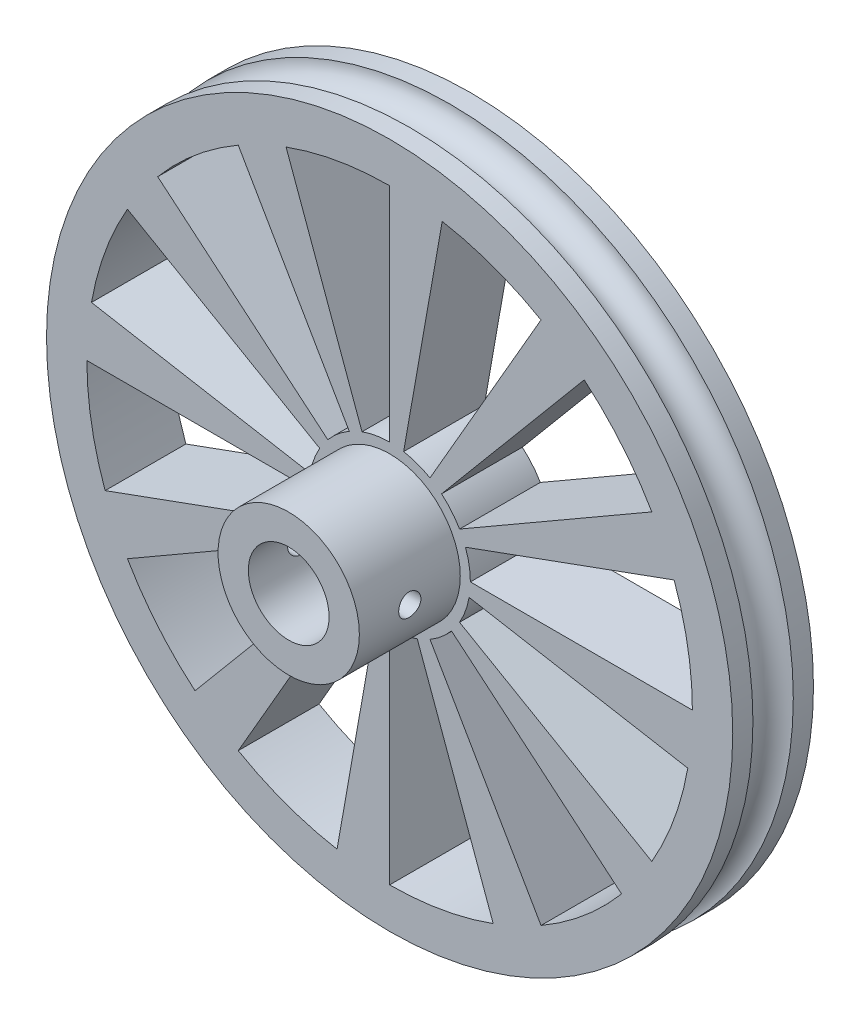
from build123d import *

# Parameters (mm, degrees)
CUT_EXTRUDE_1_REACH             = 51.112
CUT_EXTRUDE_2_REACH             = 52.08
SKETCH_4_R                      = 1.1
CUT_EXTRUDE_2_DIRECTION_2_REACH = 52.08


with BuildPart() as part:
    # 草图2 → 旋转1 (revolve)
    with BuildSketch(Plane(origin=(0, 0, 0), x_dir=(1, 0, 0), z_dir=(0, 1, 0))):
        with BuildLine():
            Line((-4, -4), (-4, 4))
            Line((-4, 4), (-34, 4))
            Line((-34, 4), (-34, 2))
            ThreePointArc((-34, 2), (-32, 0), (-34, -2))
            Line((-34, -2), (-34, -4))
            Line((-34, -4), (-7, -4))
            Line((-7, -4), (-7, -14))
            Line((-7, -14), (-4, -14))
            Line((-4, -14), (-4, -4))
        make_face()
    revolve(axis=Axis((0, 0, 0), (0, 0, -1)))

    # 草图3 → 切除-拉伸1 (cut, up to next)
    with BuildSketch(Plane.XY.offset(4), mode=Mode.PRIVATE) as cut_extrude_1_sk1:
        with BuildLine():
            Line((-30, 0), (-8, 0))
            ThreePointArc((-8, 0), (-7.878462024, -1.389185421), (-7.517540966, -2.736161147))
            Line((-7.517540966, -2.736161147), (-28.190778624, -10.2606043))
            ThreePointArc((-28.190778624, -10.2606043), (-29.54423259, -5.20944533), (-30, 0))
        make_face()
    cut_extrude_1_tool1 = extrude(cut_extrude_1_sk1.sketch, amount=-CUT_EXTRUDE_1_REACH, mode=Mode.PRIVATE) & part.part
    # 草图3 → 切除-拉伸1 (cut, up to next)
    with BuildSketch(Plane.XY.offset(4), mode=Mode.PRIVATE) as cut_extrude_1_sk2:
        with BuildLine():
            Line((-29.54423259, 5.20944533), (-7.878462024, 1.389185421))
            ThreePointArc((-7.878462024, 1.389185421), (-7.517540966, 2.736161147), (-6.92820323, 4))
            Line((-6.92820323, 4), (-25.980762114, 15))
            ThreePointArc((-25.980762114, 15), (-28.190778624, 10.2606043), (-29.54423259, 5.20944533))
        make_face()
    cut_extrude_1_tool2 = extrude(cut_extrude_1_sk2.sketch, amount=-CUT_EXTRUDE_1_REACH, mode=Mode.PRIVATE) & part.part
    # 草图3 → 切除-拉伸1 (cut, up to next)
    with BuildSketch(Plane.XY.offset(4), mode=Mode.PRIVATE) as cut_extrude_1_sk3:
        with BuildLine():
            Line((-22.981333294, 19.283628291), (-6.128355545, 5.142300877))
            ThreePointArc((-6.128355545, 5.142300877), (-5.142300877, 6.128355545), (-4, 6.92820323))
            Line((-4, 6.92820323), (-15, 25.980762114))
            ThreePointArc((-15, 25.980762114), (-19.283628291, 22.981333294), (-22.981333294, 19.283628291))
        make_face()
    cut_extrude_1_tool3 = extrude(cut_extrude_1_sk3.sketch, amount=-CUT_EXTRUDE_1_REACH, mode=Mode.PRIVATE) & part.part
    # 草图3 → 切除-拉伸1 (cut, up to next)
    with BuildSketch(Plane.XY.offset(4), mode=Mode.PRIVATE) as cut_extrude_1_sk4:
        with BuildLine():
            Line((-10.2606043, 28.190778624), (-2.736161147, 7.517540966))
            ThreePointArc((-2.736161147, 7.517540966), (-1.389185421, 7.878462024), (0, 8))
            Line((0, 8), (0, 30))
            ThreePointArc((0, 30), (-5.20944533, 29.54423259), (-10.2606043, 28.190778624))
        make_face()
    cut_extrude_1_tool4 = extrude(cut_extrude_1_sk4.sketch, amount=-CUT_EXTRUDE_1_REACH, mode=Mode.PRIVATE) & part.part
    # 草图3 → 切除-拉伸1 (cut, up to next)
    with BuildSketch(Plane.XY.offset(4), mode=Mode.PRIVATE) as cut_extrude_1_sk5:
        with BuildLine():
            Line((5.20944533, 29.54423259), (1.389185421, 7.878462024))
            ThreePointArc((1.389185421, 7.878462024), (2.736161147, 7.517540966), (4, 6.92820323))
            Line((4, 6.92820323), (15, 25.980762114))
            ThreePointArc((15, 25.980762114), (10.2606043, 28.190778624), (5.20944533, 29.54423259))
        make_face()
    cut_extrude_1_tool5 = extrude(cut_extrude_1_sk5.sketch, amount=-CUT_EXTRUDE_1_REACH, mode=Mode.PRIVATE) & part.part
    # 草图3 → 切除-拉伸1 (cut, up to next)
    with BuildSketch(Plane.XY.offset(4), mode=Mode.PRIVATE) as cut_extrude_1_sk6:
        with BuildLine():
            Line((19.283628291, 22.981333294), (5.142300877, 6.128355545))
            ThreePointArc((5.142300877, 6.128355545), (6.128355545, 5.142300877), (6.92820323, 4))
            Line((6.92820323, 4), (25.980762114, 15))
            ThreePointArc((25.980762114, 15), (22.981333294, 19.283628291), (19.283628291, 22.981333294))
        make_face()
    cut_extrude_1_tool6 = extrude(cut_extrude_1_sk6.sketch, amount=-CUT_EXTRUDE_1_REACH, mode=Mode.PRIVATE) & part.part
    # 草图3 → 切除-拉伸1 (cut, up to next)
    with BuildSketch(Plane.XY.offset(4), mode=Mode.PRIVATE) as cut_extrude_1_sk7:
        with BuildLine():
            Line((28.190778624, 10.2606043), (7.517540966, 2.736161147))
            ThreePointArc((7.517540966, 2.736161147), (7.878462024, 1.389185421), (8, 0))
            Line((8, 0), (30, 0))
            ThreePointArc((30, 0), (29.54423259, 5.20944533), (28.190778624, 10.2606043))
        make_face()
    cut_extrude_1_tool7 = extrude(cut_extrude_1_sk7.sketch, amount=-CUT_EXTRUDE_1_REACH, mode=Mode.PRIVATE) & part.part
    # 草图3 → 切除-拉伸1 (cut, up to next)
    with BuildSketch(Plane.XY.offset(4), mode=Mode.PRIVATE) as cut_extrude_1_sk8:
        with BuildLine():
            Line((29.54423259, -5.20944533), (7.878462024, -1.389185421))
            ThreePointArc((7.878462024, -1.389185421), (7.517540966, -2.736161147), (6.92820323, -4))
            Line((6.92820323, -4), (25.980762114, -15))
            ThreePointArc((25.980762114, -15), (28.190778624, -10.2606043), (29.54423259, -5.20944533))
        make_face()
    cut_extrude_1_tool8 = extrude(cut_extrude_1_sk8.sketch, amount=-CUT_EXTRUDE_1_REACH, mode=Mode.PRIVATE) & part.part
    # 草图3 → 切除-拉伸1 (cut, up to next)
    with BuildSketch(Plane.XY.offset(4), mode=Mode.PRIVATE) as cut_extrude_1_sk9:
        with BuildLine():
            Line((22.981333294, -19.283628291), (6.128355545, -5.142300877))
            ThreePointArc((6.128355545, -5.142300877), (5.142300877, -6.128355545), (4, -6.92820323))
            Line((4, -6.92820323), (15, -25.980762114))
            ThreePointArc((15, -25.980762114), (19.283628291, -22.981333294), (22.981333294, -19.283628291))
        make_face()
    cut_extrude_1_tool9 = extrude(cut_extrude_1_sk9.sketch, amount=-CUT_EXTRUDE_1_REACH, mode=Mode.PRIVATE) & part.part
    # 草图3 → 切除-拉伸1 (cut, up to next)
    with BuildSketch(Plane.XY.offset(4), mode=Mode.PRIVATE) as cut_extrude_1_sk10:
        with BuildLine():
            Line((10.2606043, -28.190778624), (2.736161147, -7.517540966))
            ThreePointArc((2.736161147, -7.517540966), (1.389185421, -7.878462024), (0, -8))
            Line((0, -8), (0, -30))
            ThreePointArc((0, -30), (5.20944533, -29.54423259), (10.2606043, -28.190778624))
        make_face()
    cut_extrude_1_tool10 = extrude(cut_extrude_1_sk10.sketch, amount=-CUT_EXTRUDE_1_REACH, mode=Mode.PRIVATE) & part.part
    # 草图3 → 切除-拉伸1 (cut, up to next)
    with BuildSketch(Plane.XY.offset(4), mode=Mode.PRIVATE) as cut_extrude_1_sk11:
        with BuildLine():
            Line((-5.20944533, -29.54423259), (-1.389185421, -7.878462024))
            ThreePointArc((-1.389185421, -7.878462024), (-2.736161147, -7.517540966), (-4, -6.92820323))
            Line((-4, -6.92820323), (-15, -25.980762114))
            ThreePointArc((-15, -25.980762114), (-10.2606043, -28.190778624), (-5.20944533, -29.54423259))
        make_face()
    cut_extrude_1_tool11 = extrude(cut_extrude_1_sk11.sketch, amount=-CUT_EXTRUDE_1_REACH, mode=Mode.PRIVATE) & part.part
    # 草图3 → 切除-拉伸1 (cut, up to next)
    with BuildSketch(Plane.XY.offset(4), mode=Mode.PRIVATE) as cut_extrude_1_sk12:
        with BuildLine():
            Line((-19.283628291, -22.981333294), (-5.142300877, -6.128355545))
            ThreePointArc((-5.142300877, -6.128355545), (-6.128355545, -5.142300877), (-6.92820323, -4))
            Line((-6.92820323, -4), (-25.980762114, -15))
            ThreePointArc((-25.980762114, -15), (-22.981333294, -19.283628291), (-19.283628291, -22.981333294))
        make_face()
    cut_extrude_1_tool12 = extrude(cut_extrude_1_sk12.sketch, amount=-CUT_EXTRUDE_1_REACH, mode=Mode.PRIVATE) & part.part
    add(cut_extrude_1_tool1.solids().sort_by_distance((-20.696454, -3.649343, 4))[0], mode=Mode.SUBTRACT)
    add(cut_extrude_1_tool2.solids().sort_by_distance((-19.748327, 7.187803, 4))[0], mode=Mode.SUBTRACT)
    add(cut_extrude_1_tool3.solids().sort_by_distance((-13.508651, 16.098984, 4))[0], mode=Mode.SUBTRACT)
    add(cut_extrude_1_tool4.solids().sort_by_distance((-3.649343, 20.696454, 4))[0], mode=Mode.SUBTRACT)
    add(cut_extrude_1_tool5.solids().sort_by_distance((7.187803, 19.748327, 4))[0], mode=Mode.SUBTRACT)
    add(cut_extrude_1_tool6.solids().sort_by_distance((16.098984, 13.508651, 4))[0], mode=Mode.SUBTRACT)
    add(cut_extrude_1_tool7.solids().sort_by_distance((20.696454, 3.649343, 4))[0], mode=Mode.SUBTRACT)
    add(cut_extrude_1_tool8.solids().sort_by_distance((19.748327, -7.187803, 4))[0], mode=Mode.SUBTRACT)
    add(cut_extrude_1_tool9.solids().sort_by_distance((13.508651, -16.098984, 4))[0], mode=Mode.SUBTRACT)
    add(cut_extrude_1_tool10.solids().sort_by_distance((3.649343, -20.696454, 4))[0], mode=Mode.SUBTRACT)
    add(cut_extrude_1_tool11.solids().sort_by_distance((-7.187803, -19.748327, 4))[0], mode=Mode.SUBTRACT)
    add(cut_extrude_1_tool12.solids().sort_by_distance((-16.098984, -13.508651, 4))[0], mode=Mode.SUBTRACT)

    # 草图4 → 切除-拉伸2 (cut, up to next)
    with BuildSketch(Plane(origin=(0, 0, 0), x_dir=(0, 0, -1), z_dir=(1, 0, 0)), mode=Mode.PRIVATE) as cut_extrude_2_sk1:
        with Locations((-9, 0)):
            Circle(SKETCH_4_R)
    cut_extrude_2_tool1 = extrude(cut_extrude_2_sk1.sketch, amount=-CUT_EXTRUDE_2_REACH, mode=Mode.PRIVATE) & part.part
    add(cut_extrude_2_tool1.solids().sort_by_distance((0, 0, 9))[0], mode=Mode.SUBTRACT)

    # 草图4 → 切除-拉伸2 direction 2 (cut, up to next)
    with BuildSketch(Plane(origin=(0, 0, 0), x_dir=(0, 0, -1), z_dir=(1, 0, 0)), mode=Mode.PRIVATE) as cut_extrude_2_direction_2_sk1:
        with Locations((-9, 0)):
            Circle(SKETCH_4_R)
    cut_extrude_2_direction_2_tool1 = extrude(cut_extrude_2_direction_2_sk1.sketch, amount=CUT_EXTRUDE_2_DIRECTION_2_REACH, mode=Mode.PRIVATE) & part.part
    add(cut_extrude_2_direction_2_tool1.solids().sort_by_distance((0, 0, 9))[0], mode=Mode.SUBTRACT)


solid = part.part
